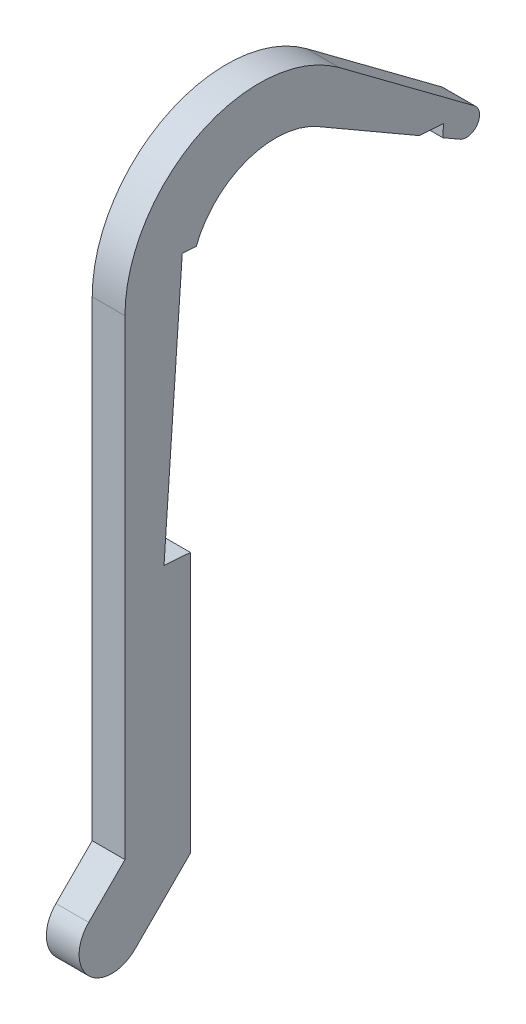
from build123d import *

# Parameters (mm, degrees)
BOSS_EXTRUDE1_DEPTH = 6.35
CUT_EXTRUDE1_DEPTH  = 116.146089719


with BuildPart() as part:
    # Sketch1 → Boss-Extrude1 (new body)
    with BuildSketch(Plane(origin=(0, 0, 0), x_dir=(0, 0, -1), z_dir=(1, 0, 0))):
        with BuildLine():
            Line((-29.21, -90.079743879), (-29.21, 1.27))
            ThreePointArc((-29.21, 1.27), (-14.855715079, 24.537619565), (12.378793565, 22.148235815))
            Line((12.378793565, 22.148235815), (38.538749845, 2.659684997))
            ThreePointArc((38.538749845, 2.659684997), (39.143219329, -0.773312847), (35.75130657, -1.576920584))
            Line((35.75130657, -1.576920584), (8.255, 14.298079416))
            ThreePointArc((8.255, 14.298079416), (-8.255, 14.298079416), (-16.51, 0))
            Line((-16.51, 0), (-16.51, -95.340256121))
            Line((-16.51, -95.340256121), (-27.259871939, -106.090128061))
            ThreePointArc((-27.259871939, -106.090128061), (-36.240128061, -106.090128061), (-36.240128061, -97.109871939))
            Line((-36.240128061, -97.109871939), (-29.21, -90.079743879))
        make_face()
    extrude(amount=BOSS_EXTRUDE1_DEPTH)

    # Sketch4 → Cut-Extrude1 (cut, through all)
    with BuildSketch(Plane.ZY):
        Polygon((-32.581569527, 2.655599133), (18.094684226, 6.199227999), (21.638313093, -44.477025754), (-29.037940661, -48.02065462), align=None)
    extrude(amount=-CUT_EXTRUDE1_DEPTH, mode=Mode.SUBTRACT)


solid = part.part
